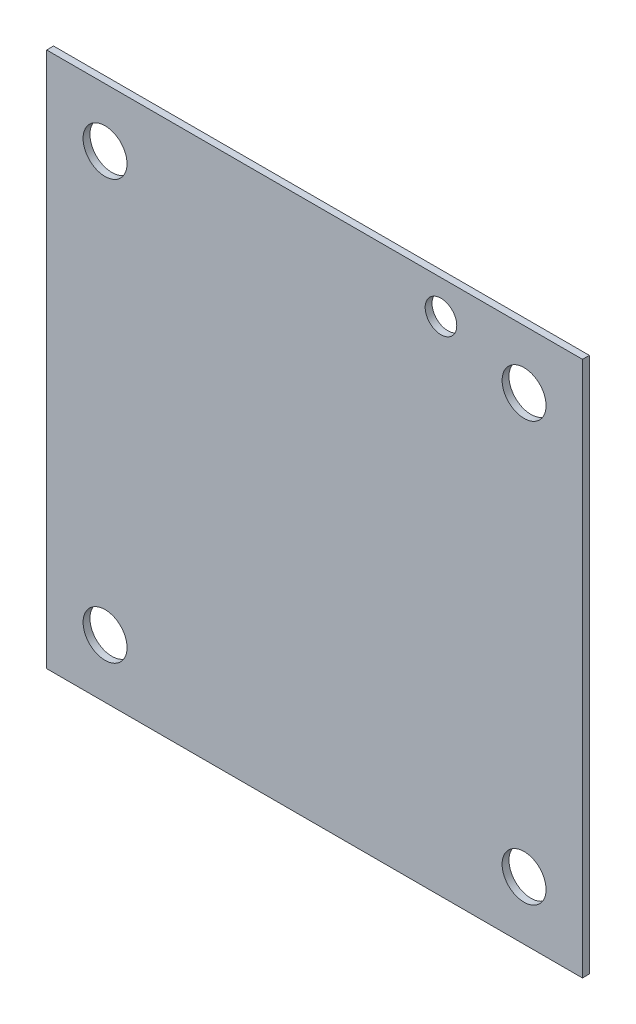
from build123d import *

# Parameters (mm, degrees)
SKETCH1_W           = 39
SKETCH1_H           = 39
SKETCH1_R           = 1.6
SKETCH1_R_2         = 1.15
BOSS_EXTRUDE1_DEPTH = 0.5


with BuildPart() as part:
    # Sketch1 → Boss-Extrude1 (new body)
    with BuildSketch(Plane.XY):
        Rectangle(SKETCH1_W, SKETCH1_H)
        with Locations((-15.25, -15.25)):
            Circle(SKETCH1_R, mode=Mode.SUBTRACT)
        with Locations((15.25, -15.25)):
            Circle(SKETCH1_R, mode=Mode.SUBTRACT)
        with Locations((-15.25, 15.25)):
            Circle(SKETCH1_R, mode=Mode.SUBTRACT)
        with Locations((9.2, 17.05)):
            Circle(SKETCH1_R_2, mode=Mode.SUBTRACT)
        with Locations((15.25, 15.25)):
            Circle(SKETCH1_R, mode=Mode.SUBTRACT)
    extrude(amount=BOSS_EXTRUDE1_DEPTH)


solid = part.part
